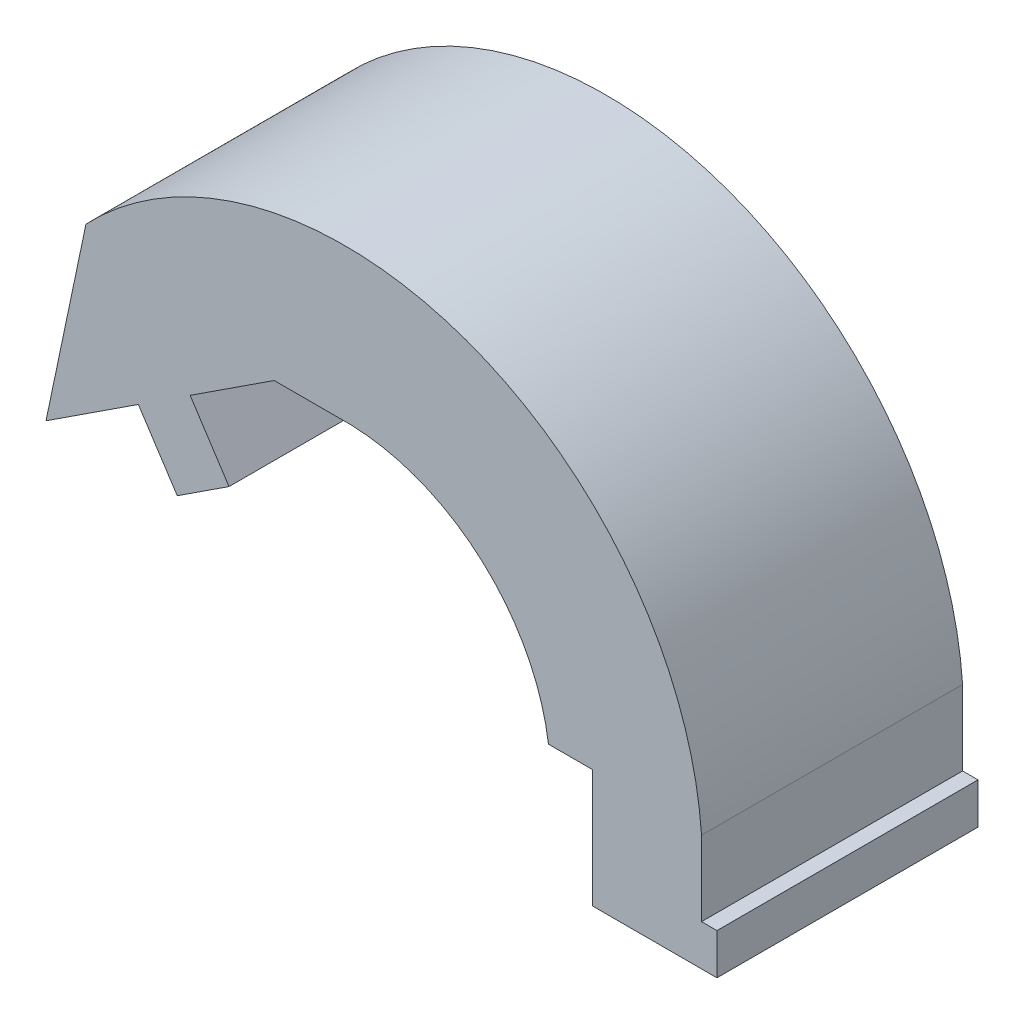
from build123d import *

# Parameters (mm, degrees)
BOSS_EXTRUDE1_DEPTH = 12.7


with BuildPart() as part:
    # Sketch3 → Boss-Extrude1 (new body)
    with BuildSketch(Plane.XY):
        with BuildLine():
            Line((-39.005790355, 10.53121299), (-39.218474284, 10.392354983))
            Line((-39.218474284, 10.392354983), (-43.499378585, 7.5974196))
            Line((-43.499378585, 7.5974196), (-41.554472098, 16.858613649))
            ThreePointArc((-41.554472098, 16.858613649), (-23.072731373, 21.222442639), (-11.60681582, 6.084724045))
            Line((-11.60681582, 6.084724045), (-11.60681582, 5.15464013))
            Line((-11.60681582, 5.15464013), (-11.60681582, 2.440752288))
            Line((-11.60681582, 2.440752288), (-10.85681582, 2.440752288))
            Line((-10.85681582, 2.440752288), (-10.85681582, 0.448752288))
            Line((-10.85681582, 0.448752288), (-16.916890922, 0.448752288))
            Line((-16.916890922, 0.448752288), (-16.916890922, 6.194752288))
            Line((-16.916890922, 6.194752288), (-19.053799306, 6.194752288))
            ThreePointArc((-19.053799306, 6.194752288), (-22.267073307, 12.277081543), (-28.648818682, 14.844801335))
            Line((-28.648818682, 14.844801335), (-32.398818682, 14.844801335))
            Line((-32.398818682, 14.844801335), (-36.274694656, 12.314302605))
            Line((-36.274694656, 12.314302605), (-36.487378586, 12.175444598))
            Line((-36.487378586, 12.175444598), (-34.594910878, 9.276818319))
            Line((-34.594910878, 9.276818319), (-37.113322647, 7.632586711))
            Line((-37.113322647, 7.632586711), (-39.005790355, 10.53121299))
        make_face()
    extrude(amount=-BOSS_EXTRUDE1_DEPTH)


solid = part.part
